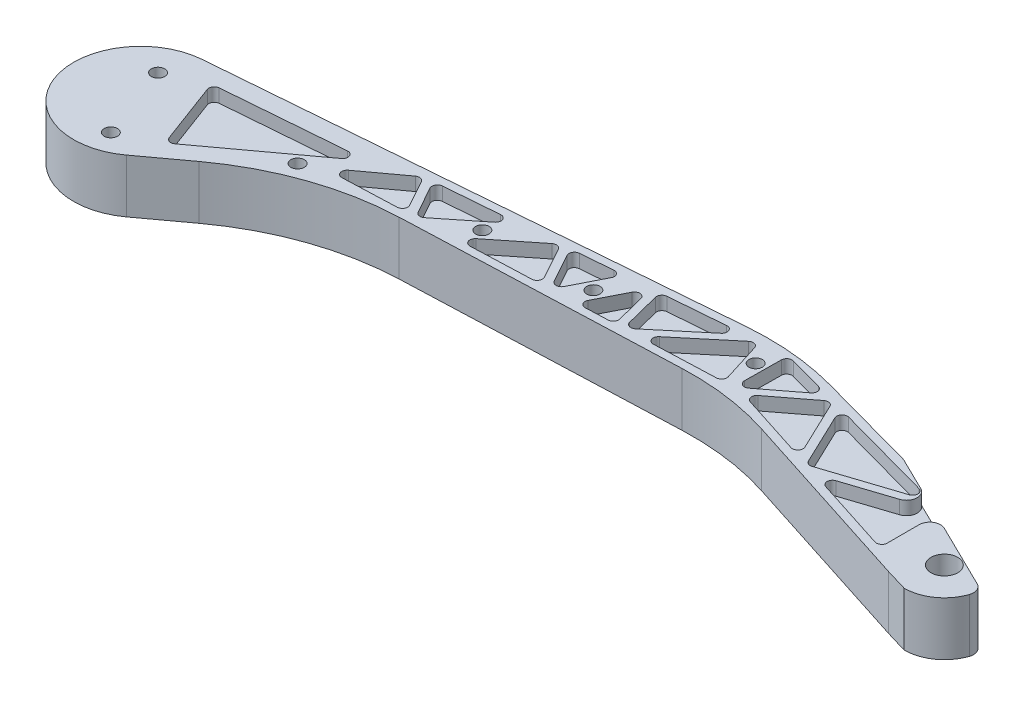
from build123d import *

# Parameters (mm, degrees)
BOSS_EXTRUDE1_DEPTH      = 10
BOSS_EXTRUDE1_DEPTH_BACK = 10
SKETCH1_R                = 5
FILLET1_R                = 100
SKETCH2_R                = 2.5
CUT_EXTRUDE1_DEPTH       = 5
FILLET2_R                = 2
FILLET2_OF_MIRROR2_R     = 2
CUT_EXTRUDE2_DEPTH       = 20
FILLET5_R                = 4


with BuildPart() as part:
    # Sketch1 → Boss-Extrude1 (new, two sides: drawn at the far end of the back side and taken through both)
    with BuildSketch(Plane(origin=(0, 0, 0), x_dir=(1, 0, 0), z_dir=(0, 1, 0)).offset(-BOSS_EXTRUDE1_DEPTH_BACK)):
        with BuildLine():
            Line((0, 15), (-96.417851723, 41.525419301))
            Line((-96.417851723, 41.525419301), (-302.012777379, 24.918842815))
            ThreePointArc((-302.012777379, 24.918842815), (-323.422288966, -8.74050225), (-285.196078396, -20.145567878))
            Line((-285.196078396, -20.145567878), (-244.853395733, 9.500154448))
            Line((-244.853395733, 9.500154448), (-94.853395733, 15.263592787))
            Line((-94.853395733, 15.263592787), (-8.209432186, -12.55409189))
            Line((-8.209432186, -12.55409189), (0, -15))
            ThreePointArc((0, -15), (15, 0), (0, 15))
        make_face()
        with Locations(Location((0, 0, 0), (0, 0, 270))):
            Circle(SKETCH1_R, mode=Mode.SUBTRACT)
    extrude(amount=BOSS_EXTRUDE1_DEPTH + BOSS_EXTRUDE1_DEPTH_BACK)

    # Fillet1
    fillet1_edges = [part.edges().sort_by_distance(p)[0] for p in [
        (-96.417851723, 0, -41.525419301),
        (0, 0, -15),
        (-94.853395733, 0, -15.263592787),
        (-244.853395733, 0, -9.500154448),
    ]]
    fillet(fillet1_edges, radius=FILLET1_R)

    # Sketch2 → Cut-Extrude1 (cut)
    with BuildSketch(Plane(origin=(0, 10, 0), x_dir=(1, 0, 0), z_dir=(0, 1, 0))):
        with Locations(Location((-100.410325029, 29.966674425, 0), (0, 0, 270))):
            Circle(SKETCH2_R)
        with Locations(Location((-154.331360865, 23.327852047, 0), (0, 0, 270))):
            Circle(SKETCH2_R)
        with Locations(Location((-194.43609766, 21.998076888, 0), (0, 0, 270))):
            Circle(SKETCH2_R)
        with Locations(Location((-250.479012244, 9.089087069, 0), (0, 0, 270))):
            Circle(SKETCH2_R)
        with Locations(Location((-305.880435037, 12.401187858, 0), (0, 0, 270))):
            Circle(SKETCH2_R)
        with Locations(Location((-295.391832737, -15.705559051, 0), (0, 0, 270))):
            Circle(SKETCH2_R)
        Polygon((-292.21586201, 18.687373798), (-281.876511166, -9.019417731), (-238.23936591, 23.047232428), align=None)
        Polygon((-17.754718765, 16.773026019), (-17.754718765, -6.33868172), (-53.365436428, 5.0944023), align=None)
        Polygon((-22.990022437, 18.213305206), (-69.89582428, 31.117513703), (-58.230092835, 6.656236183), align=None)
        Polygon((-62.154702225, 7.916261025), (-73.721446188, 32.169976742), (-92.622909187, 17.698303988), align=None)
        Polygon((-77.35185331, 33.168734435), (-96.92030532, 18.186389746), (-96.703582242, 38.492569336), align=None)
        Polygon((-244.106325436, 12.531072737), (-222.617491874, 28.322089864), (-214.487999018, 13.66909539), align=None)
        Polygon((-106.555479442, 37.696799286), (-100.410325029, 18.05229299), (-131.520316701, 16.856956198), align=None)
        Polygon((-111.738383291, 37.278159142), (-136.427588937, 16.668404458), (-141.03422906, 34.911837591), align=None)
        Polygon((-144.066545636, 34.666907435), (-139.492021115, 16.550660019), (-153.569970314, 16.009744071), align=None)
        Polygon((-153.429835368, 33.910603812), (-162.727242525, 15.657894913), (-172.020743917, 32.408955151), align=None)
        Polygon((-175.304372068, 32.143725735), (-166.086412512, 15.528825786), (-197.65154914, 14.316000995), align=None)
        Polygon((-219.333863723, 28.58731928), (-211.128829032, 13.798164517), (-189.577714365, 30.990821062), align=None)
    cut_extrude1 = extrude(amount=-CUT_EXTRUDE1_DEPTH, mode=Mode.SUBTRACT)

    # Fillet2
    fillet2_edges = [part.edges().sort_by_distance(p)[0] for p in [
        (-96.92030532, 7.5, -18.186389746),
        (-96.703582242, 7.5, -38.492569336),
        (-77.35185331, 7.5, -33.168734435),
        (-53.365436428, 7.5, -5.0944023),
        (-17.754718765, 7.5, -16.773026019),
        (-17.754718765, 7.5, 6.33868172),
        (-22.990022437, 7.5, -18.213305206),
        (-58.230092835, 7.5, -6.656236183),
        (-69.89582428, 7.5, -31.117513703),
        (-62.154702225, 7.5, -7.916261025),
        (-92.622909187, 7.5, -17.698303988),
        (-73.721446188, 7.5, -32.169976742),
        (-214.487999018, 7.5, -13.66909539),
        (-244.106325436, 7.5, -12.531072737),
        (-222.617491874, 7.5, -28.322089864),
        (-219.333863723, 7.5, -28.58731928),
        (-189.577714365, 7.5, -30.990821062),
        (-211.128829032, 7.5, -13.798164517),
        (-172.020743917, 7.5, -32.408955151),
        (-153.429835368, 7.5, -33.910603812),
        (-162.727242525, 7.5, -15.657894913),
        (-141.03422906, 7.5, -34.911837591),
        (-111.738383291, 7.5, -37.278159142),
        (-136.427588937, 7.5, -16.668404458),
        (-131.520316701, 7.5, -16.856956198),
        (-106.555479442, 7.5, -37.696799286),
        (-100.410325029, 7.5, -18.05229299),
        (-153.569970314, 7.5, -16.009744071),
        (-144.066545636, 7.5, -34.666907435),
        (-139.492021115, 7.5, -16.550660019),
        (-197.65154914, 7.5, -14.316000995),
        (-175.304372068, 7.5, -32.143725735),
        (-166.086412512, 7.5, -15.528825786),
        (-292.21586201, 7.5, -18.687373798),
        (-238.23936591, 7.5, -23.047232428),
        (-281.876511166, 7.5, 9.019417731),
    ]]
    fillet(fillet2_edges, radius=FILLET2_R)

    # Mirror2: Cut-Extrude1 across plane
    add(cut_extrude1.mirror(Plane.ZX), mode=Mode.SUBTRACT)

    # Fillet2 of Mirror2
    fillet2_of_mirror2_edges = [part.edges().sort_by_distance(p)[0] for p in [
        (-96.92030532, -7.5, -18.186389746),
        (-96.703582242, -7.5, -38.492569336),
        (-77.35185331, -7.5, -33.168734435),
        (-53.365436428, -7.5, -5.0944023),
        (-17.754718765, -7.5, -16.773026019),
        (-17.754718765, -7.5, 6.33868172),
        (-22.990022437, -7.5, -18.213305206),
        (-58.230092835, -7.5, -6.656236183),
        (-69.89582428, -7.5, -31.117513703),
        (-62.154702225, -7.5, -7.916261025),
        (-92.622909187, -7.5, -17.698303988),
        (-73.721446188, -7.5, -32.169976742),
        (-214.487999018, -7.5, -13.66909539),
        (-244.106325436, -7.5, -12.531072737),
        (-222.617491874, -7.5, -28.322089864),
        (-219.333863723, -7.5, -28.58731928),
        (-189.577714365, -7.5, -30.990821062),
        (-211.128829032, -7.5, -13.798164517),
        (-172.020743917, -7.5, -32.408955151),
        (-153.429835368, -7.5, -33.910603812),
        (-162.727242525, -7.5, -15.657894913),
        (-141.03422906, -7.5, -34.911837591),
        (-111.738383291, -7.5, -37.278159142),
        (-136.427588937, -7.5, -16.668404458),
        (-131.520316701, -7.5, -16.856956198),
        (-106.555479442, -7.5, -37.696799286),
        (-100.410325029, -7.5, -18.05229299),
        (-153.569970314, -7.5, -16.009744071),
        (-144.066545636, -7.5, -34.666907435),
        (-139.492021115, -7.5, -16.550660019),
        (-197.65154914, -7.5, -14.316000995),
        (-175.304372068, -7.5, -32.143725735),
        (-166.086412512, -7.5, -15.528825786),
        (-292.21586201, -7.5, -18.687373798),
        (-238.23936591, -7.5, -23.047232428),
        (-281.876511166, -7.5, 9.019417731),
    ]]
    fillet(fillet2_of_mirror2_edges, radius=FILLET2_OF_MIRROR2_R)

    # Sketch3 → Cut-Extrude2 (cut)
    with BuildSketch(Plane(origin=(0, 10, 0), x_dir=(1, 0, 0), z_dir=(0, 1, 0))):
        Polygon((-41.707438822, 26.474092017), (14.944717586, -1.286629818), (35.098976784, 39.842785014), align=None)
    extrude(amount=-CUT_EXTRUDE2_DEPTH, mode=Mode.SUBTRACT)

    # Fillet5
    # the kernel refuses this fillet: 4 mm, written as the material it takes off along each edge
    with BuildSketch(Plane(origin=(14.944717586, 18.986980531, 1.286629818), x_dir=(-0.8979830036902616, 0, -0.440030141107874), z_dir=(0, -1, 0))) as fillet5_piece_1:
        with BuildLine():
            CenterArc((3.078396136, -4), FILLET5_R, 90, 82.578974363)
            ThreePointArc((-0.888099192, -3.483362008), (-0.548776571, -1.714980379), (0, 0))
            Line((0, 0), (3.078396136, 0))
        make_face()
    extrude(amount=37.973961062, mode=Mode.SUBTRACT)
    with BuildSketch(Plane(origin=(-17.925196253, -26.510886142, -14.820304016), x_dir=(0.8979830036902615, 0, 0.4400301411078742), z_dir=(0, 1, 0))) as fillet5_piece_2:
        with BuildLine():
            CenterArc((6.604354457, -4), FILLET5_R, 90, 116.105804274)
            Line((3.012422442, -5.760120564), (2.65322924, -5.936132621))
            ThreePointArc((2.65322924, -5.936132621), (0.149432513, -0.826557854), (-0.257468059, -0.306121216))
            Line((-0.257468059, -0.306121216), (0, 0.4))
            Line((0, 0.4), (6.604354457, 0.4))
            Line((6.604354457, 0.4), (6.604354457, 0))
        make_face()
    extrude(amount=21.510886142, mode=Mode.SUBTRACT)
    with BuildSketch(Plane(origin=(-17.925196253, -26.510886142, -14.820304016), x_dir=(0.8979830036902615, 0, 0.4400301411078742), z_dir=(0, 1, 0))) as fillet5_piece_3_section:
        with BuildLine():
            CenterArc((6.604354457, -4), FILLET5_R, 90, 116.105804274)
            Line((3.012422442, -5.760120564), (2.65322924, -5.936132621))
            ThreePointArc((2.65322924, -5.936132621), (0.149432513, -0.826557854), (-0.257468059, -0.306121216))
            Line((-0.257468059, -0.306121216), (0, 0.4))
            Line((0, 0.4), (6.604354457, 0.4))
            Line((6.604354457, 0.4), (6.604354457, 0))
        make_face()
    fillet5_piece_3 = extrude(amount=38.021772283, mode=Mode.PRIVATE)
    fillet5_piece_3 = split(fillet5_piece_3, bisect_by=Plane(origin=(-16.263176615, 5, -12.63851962), z_dir=(0, 1, 0)), keep=Keep.TOP, mode=Mode.PRIVATE)
    add(fillet5_piece_3, mode=Mode.SUBTRACT)
    with BuildSketch(Plane(origin=(-20.237215659, -34.607550768, -15.953241077), x_dir=(-0.8979830036902615, 0, -0.4400301411078745), z_dir=(0, 1, 0))) as fillet5_piece_4:
        with BuildLine():
            CenterArc((9.843020307, 4), FILLET5_R, 134.262837271, 135.737162729)
            Line((7.05121658, 6.864582335), (6.772036208, 7.151040568))
            ThreePointArc((6.772036208, 7.151040568), (-0.170618802, 0.384773146), (-0.257468059, 0.306121216))
            Line((-0.257468059, 0.306121216), (0, -0.4))
            Line((0, -0.4), (9.843020307, -0.4))
            Line((9.843020307, -0.4), (9.843020307, 0))
        make_face()
    extrude(amount=29.607550768, mode=Mode.SUBTRACT)
    with BuildSketch(Plane(origin=(-20.237215659, -34.607550768, -15.953241077), x_dir=(-0.8979830036902615, 0, -0.4400301411078745), z_dir=(0, 1, 0))) as fillet5_piece_5_section:
        with BuildLine():
            CenterArc((9.843020307, 4), FILLET5_R, 134.262837271, 135.737162729)
            Line((7.05121658, 6.864582335), (6.772036208, 7.151040568))
            ThreePointArc((6.772036208, 7.151040568), (-0.170618802, 0.384773146), (-0.257468059, 0.306121216))
            Line((-0.257468059, 0.306121216), (0, -0.4))
            Line((0, -0.4), (9.843020307, -0.4))
            Line((9.843020307, -0.4), (9.843020307, 0))
        make_face()
    fillet5_piece_5 = extrude(amount=54.215101535, mode=Mode.PRIVATE)
    fillet5_piece_5 = split(fillet5_piece_5, bisect_by=Plane(origin=(-24.905354337, 5, -16.325935643), z_dir=(0, 1, 0)), keep=Keep.TOP, mode=Mode.PRIVATE)
    add(fillet5_piece_5, mode=Mode.SUBTRACT)
    with BuildSketch(Plane(origin=(-17.925196253, 26.510886142, -14.820304016), x_dir=(0.8979830036902615, 0, 0.4400301411078742), z_dir=(0, -1, 0))) as fillet5_piece_6:
        with BuildLine():
            CenterArc((6.604354457, 4), FILLET5_R, 153.894195726, 116.105804274)
            Line((3.012422442, 5.760120564), (2.65322924, 5.936132621))
            ThreePointArc((2.65322924, 5.936132621), (0.149432513, 0.826557854), (-0.257468059, 0.306121216))
            Line((-0.257468059, 0.306121216), (0, -0.4))
            Line((0, -0.4), (6.604354457, -0.4))
            Line((6.604354457, -0.4), (6.604354457, 0))
        make_face()
    extrude(amount=21.510886142, mode=Mode.SUBTRACT)
    with BuildSketch(Plane(origin=(-17.925196253, 26.510886142, -14.820304016), x_dir=(0.8979830036902615, 0, 0.4400301411078742), z_dir=(0, -1, 0))) as fillet5_piece_7_section:
        with BuildLine():
            CenterArc((6.604354457, 4), FILLET5_R, 153.894195726, 116.105804274)
            Line((3.012422442, 5.760120564), (2.65322924, 5.936132621))
            ThreePointArc((2.65322924, 5.936132621), (0.149432513, 0.826557854), (-0.257468059, 0.306121216))
            Line((-0.257468059, 0.306121216), (0, -0.4))
            Line((0, -0.4), (6.604354457, -0.4))
            Line((6.604354457, -0.4), (6.604354457, 0))
        make_face()
    fillet5_piece_7 = extrude(amount=38.021772283, mode=Mode.PRIVATE)
    fillet5_piece_7 = split(fillet5_piece_7, bisect_by=Plane(origin=(-16.263176615, -5, -12.63851962), z_dir=(0, -1, 0)), keep=Keep.TOP, mode=Mode.PRIVATE)
    add(fillet5_piece_7, mode=Mode.SUBTRACT)
    with BuildSketch(Plane(origin=(-20.237215659, 34.607550768, -15.953241077), x_dir=(-0.8979830036902615, 0, -0.4400301411078745), z_dir=(0, -1, 0))) as fillet5_piece_8:
        with BuildLine():
            CenterArc((9.843020307, -4), FILLET5_R, 90, 135.737162729)
            Line((7.05121658, -6.864582335), (6.772036208, -7.151040568))
            ThreePointArc((6.772036208, -7.151040568), (-0.170618802, -0.384773146), (-0.257468059, -0.306121216))
            Line((-0.257468059, -0.306121216), (0, 0.4))
            Line((0, 0.4), (9.843020307, 0.4))
            Line((9.843020307, 0.4), (9.843020307, 0))
        make_face()
    extrude(amount=29.607550768, mode=Mode.SUBTRACT)
    with BuildSketch(Plane(origin=(-20.237215659, 34.607550768, -15.953241077), x_dir=(-0.8979830036902615, 0, -0.4400301411078745), z_dir=(0, -1, 0))) as fillet5_piece_9_section:
        with BuildLine():
            CenterArc((9.843020307, -4), FILLET5_R, 90, 135.737162729)
            Line((7.05121658, -6.864582335), (6.772036208, -7.151040568))
            ThreePointArc((6.772036208, -7.151040568), (-0.170618802, -0.384773146), (-0.257468059, -0.306121216))
            Line((-0.257468059, -0.306121216), (0, 0.4))
            Line((0, 0.4), (9.843020307, 0.4))
            Line((9.843020307, 0.4), (9.843020307, 0))
        make_face()
    fillet5_piece_9 = extrude(amount=54.215101535, mode=Mode.PRIVATE)
    fillet5_piece_9 = split(fillet5_piece_9, bisect_by=Plane(origin=(-24.905354337, -5, -16.325935643), z_dir=(0, -1, 0)), keep=Keep.TOP, mode=Mode.PRIVATE)
    add(fillet5_piece_9, mode=Mode.SUBTRACT)


solid = part.part
